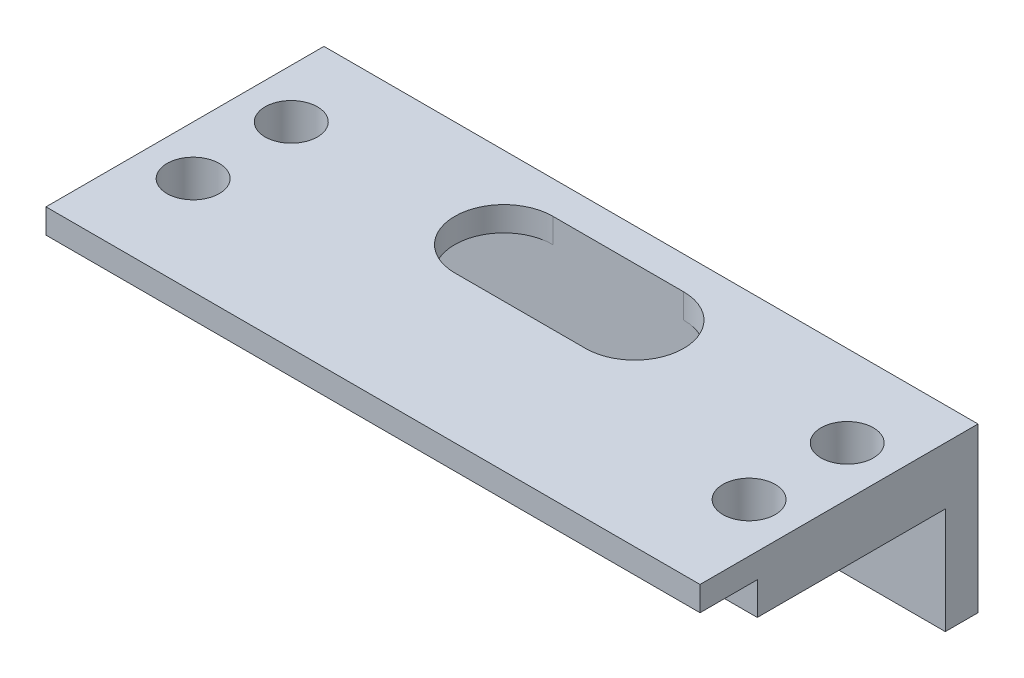
from build123d import *

# Parameters (mm, degrees)
EXTRUDE_1_DEPTH     = 40
SKETCH_2_R          = 1.6
CUT_EXTRUDE_1_DEPTH = 10
CUT_EXTRUDE_2_DEPTH = 2


with BuildPart() as part:
    # 草图1 → 凸台-拉伸1 (new body)
    with BuildSketch(Plane(origin=(0, 0, 0), x_dir=(0, 0, -1), z_dir=(1, 0, 0))):
        Polygon((0, 0), (-15, 0), (-15, 3.5), (2, 3.5), (2, -6.5), (0, -6.5), align=None)
    extrude(amount=EXTRUDE_1_DEPTH)

    # 草图2 → 切除-拉伸1 (cut)
    with BuildSketch(Plane(origin=(0, 3.5, 0), x_dir=(1, 0, 0), z_dir=(0, 1, 0))):
        with Locations((3, -3)):
            Circle(SKETCH_2_R)
        with Locations((3, -9)):
            Circle(SKETCH_2_R)
        with Locations((37, -9)):
            Circle(SKETCH_2_R)
        with Locations((37, -3)):
            Circle(SKETCH_2_R)
        with BuildLine():
            Line((24, 0), (16, 0))
            ThreePointArc((16, 0), (13, -3), (16, -6))
            Line((16, -6), (24, -6))
            ThreePointArc((24, -6), (27, -3), (24, 0))
        make_face()
    extrude(amount=-CUT_EXTRUDE_1_DEPTH, mode=Mode.SUBTRACT)

    # 草图3 → 切除-拉伸2 (cut)
    with BuildSketch(Plane.XZ):
        with BuildLine():
            Line((3, 11.5), (0, 11.5))
            Line((0, 11.5), (0, 15))
            Line((0, 15), (40, 15))
            Line((40, 15), (40, 11.5))
            Line((40, 11.5), (37, 11.5))
            ThreePointArc((37, 11.5), (35.232233047, 10.767766953), (34.5, 9))
            Line((34.5, 9), (34.5, 0))
            Line((34.5, 0), (5.5, 0))
            Line((5.5, 0), (5.5, 9))
            ThreePointArc((5.5, 9), (4.767766953, 10.767766953), (3, 11.5))
        make_face()
    extrude(amount=-CUT_EXTRUDE_2_DEPTH, mode=Mode.SUBTRACT)


solid = part.part
